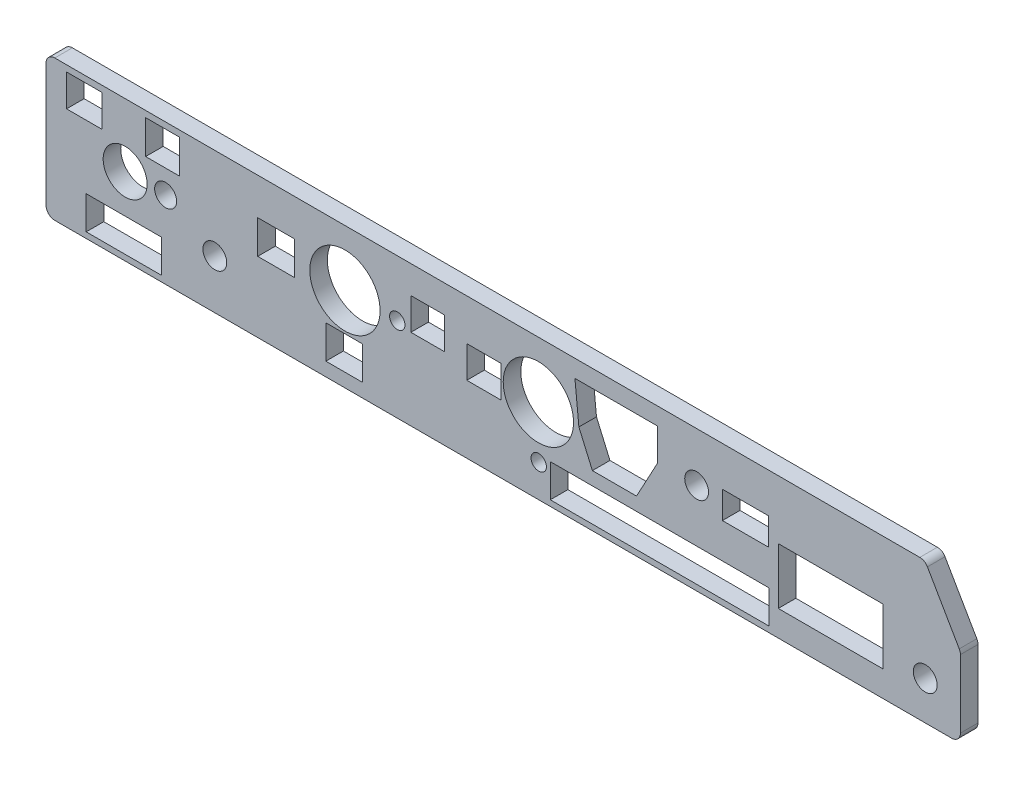
from build123d import *

# Parameters (mm, degrees)
BOSS_EXTRUDE1_DEPTH             = 3.175
F_1_2_0_5_DIAMETER_HOLE1_D      = 12.7
F_5_16_0_3125_DIAMETER_HOLE1_D  = 7.9375
F_5_32_0_15625_DIAMETER_HOLE1_D = 3.96875
F_7_64_0_10938_DIAMETER_HOLE1_D = 2.778252
F_6_CLEARANCE_HOLE1_D           = 4.3053
SKETCH12_W                      = 13.628843106
SKETCH12_H                      = 5.967659112
SKETCH12_W_2                    = 6.411201343
SKETCH12_H_2                    = 5.766049007
SKETCH12_W_3                    = 6.128947195
SKETCH12_H_3                    = 6.088625175
SKETCH12_W_4                    = 6.612811448
SKETCH12_H_4                    = 6.048303153
SKETCH12_H_5                    = 6.007981133
SKETCH12_W_5                    = 6.036712015
SKETCH12_H_6                    = 5.740571426
SKETCH12_W_6                    = 6.150612242
SKETCH12_H_7                    = 5.740571425
SKETCH12_W_7                    = 39.487797625
CUT_EXTRUDE1_DEPTH              = 168.072590885
SKETCH13_W                      = 8.365810606
SKETCH13_H                      = 4.902824617
SKETCH13_W_2                    = 18.871149451
SKETCH13_H_2                    = 10.139755372
CUT_EXTRUDE2_DEPTH              = 168.072590885


with BuildPart() as part:
    # Sketch1 → Boss-Extrude1 (new body)
    with BuildSketch(Plane.XY):
        with BuildLine():
            Line((157.767651581, 0), (1.5875, 0))
            ThreePointArc((1.5875, 0), (0.464967985, -0.464967985), (0, -1.5875))
            Line((0, -1.5875), (0, -23.8125))
            ThreePointArc((0, -23.8125), (0.464967985, -24.935032015), (1.5875, -25.4))
            Line((1.5875, -25.4), (163.5125, -25.4))
            ThreePointArc((163.5125, -25.4), (164.635032015, -24.935032015), (165.1, -23.8125))
            Line((165.1, -23.8125), (165.1, -11.537869343))
            ThreePointArc((165.1, -11.537869343), (165.045907249, -11.126994109), (164.887315329, -10.744119343))
            Line((164.887315329, -10.744119343), (159.14246691, -0.79375))
            ThreePointArc((159.14246691, -0.79375), (158.561401581, -0.212684671), (157.767651581, 0))
        make_face()
    extrude(amount=BOSS_EXTRUDE1_DEPTH)

    # 1/2 (0.5) Diameter Hole1 (through all)
    with Locations(Plane(origin=(0, 0, 0), x_dir=(-1, 0, 0), z_dir=(0, 0, -1))):
        with Locations((-53.975, -10.16), (-88.9, -10.16)):
            Hole(F_1_2_0_5_DIAMETER_HOLE1_D / 2)

    # 5/16 (0.3125) Diameter Hole1 (through all)
    with Locations(Plane(origin=(0, 0, 0), x_dir=(-1, 0, 0), z_dir=(0, 0, -1))):
        with Locations((-14.2875, -11.43)):
            Hole(F_5_16_0_3125_DIAMETER_HOLE1_D / 2)

    # 5/32 (0.15625) Diameter Hole1 (through all)
    with Locations(Plane(origin=(0, 0, 0), x_dir=(-1, 0, 0), z_dir=(0, 0, -1))):
        with Locations((-21.598282462, -11.43)):
            Hole(F_5_32_0_15625_DIAMETER_HOLE1_D / 2)

    # 7/64 (0.10938) Diameter Hole1 (through all)
    with Locations(Plane(origin=(0, 0, 0), x_dir=(-1, 0, 0), z_dir=(0, 0, -1))):
        with Locations((-88.959471598, -19.537541197), (-63.423407807, -10.16)):
            Hole(F_7_64_0_10938_DIAMETER_HOLE1_D / 2)

    # #6 Clearance Hole1 (through all)
    with Locations(Plane(origin=(0, 0, 0), x_dir=(-1, 0, 0), z_dir=(0, 0, -1))):
        with Locations((-158.75, -18.415), (-117.475, -8.89), (-30.48, -16.51)):
            Hole(F_6_CLEARANCE_HOLE1_D / 2)

    # Sketch12 → Cut-Extrude1 (cut, through all)
    with BuildSketch(Plane(origin=(0, 0, 0), x_dir=(-1, 0, 0), z_dir=(0, 0, -1))):
        Polygon((-98.650411966, -15.990386573), (-106.620324434, -15.990386573), (-110.367372834, -9.031582403), (-110.367372834, -3.14336349), (-95.498133154, -3.14336349), (-96.2140393, -10.38700227), align=None)
        with Locations((-14.07350902, -21.369743495)):
            Rectangle(SKETCH12_W, SKETCH12_H)
        with Locations((-6.916350289, -4.011113444)):
            Rectangle(SKETCH12_W_2, SKETCH12_H_2)
        with Locations((-21.049218657, -4.172401527)):
            Rectangle(SKETCH12_W_3, SKETCH12_H_3)
        with Locations((-41.532805338, -9.676357398)):
            Rectangle(SKETCH12_W_4, SKETCH12_H_4)
        with Locations((-53.83102175, -19.938311749)):
            Rectangle(SKETCH12_W_4, SKETCH12_H_5)
        with Locations((-68.898072428, -7.877918741)):
            Rectangle(SKETCH12_W_5, SKETCH12_H_6)
        with Locations((-79.046582627, -10.338163638)):
            Rectangle(SKETCH12_W_6, SKETCH12_H_7)
        with Locations((-110.795595147, -21.369743495)):
            Rectangle(SKETCH12_W_7, SKETCH12_H)
    extrude(amount=-CUT_EXTRUDE1_DEPTH, mode=Mode.SUBTRACT)

    # Sketch13 → Cut-Extrude2 (cut, through all)
    with BuildSketch(Plane(origin=(0, 0, 0), x_dir=(-1, 0, 0), z_dir=(0, 0, -1))):
        with Locations((-126.308359578, -9.613501929)):
            Rectangle(SKETCH13_W, SKETCH13_H)
        with Locations((-141.646644884, -15.691516251)):
            Rectangle(SKETCH13_W_2, SKETCH13_H_2)
    extrude(amount=-CUT_EXTRUDE2_DEPTH, mode=Mode.SUBTRACT)


solid = part.part
